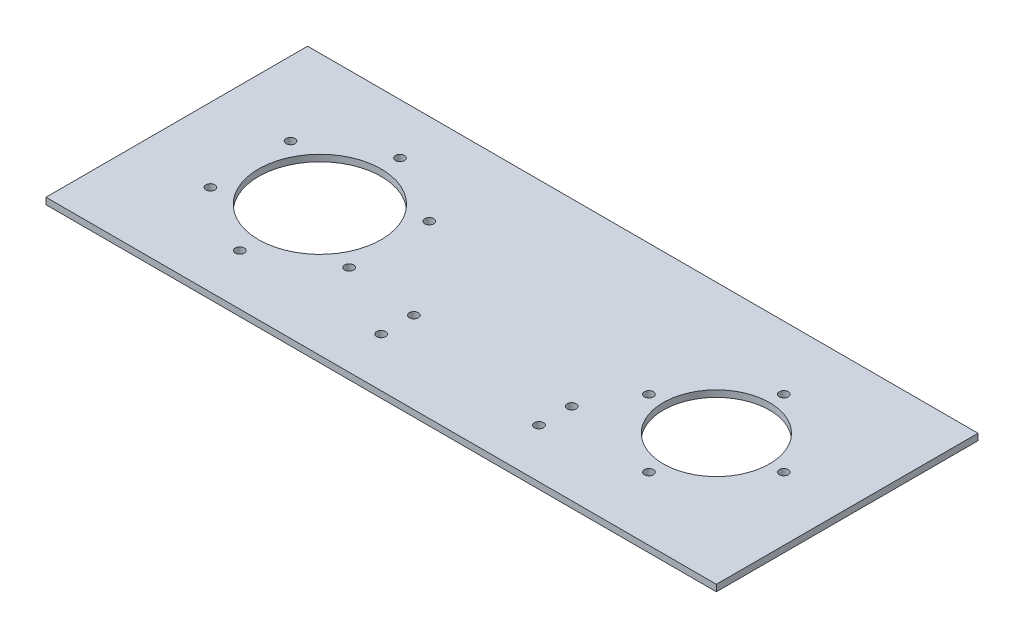
from build123d import *

# Parameters (mm, degrees)
SKETCH1_W           = 820
SKETCH1_H           = 320
SKETCH1_R           = 5.5
SKETCH1_R_2         = 75
SKETCH1_R_3         = 65
BOSS_EXTRUDE1_DEPTH = 8
SKETCH2_R           = 5.5
CUT_EXTRUDE2_DEPTH  = 10


with BuildPart() as part:
    # Sketch1 → Boss-Extrude1 (new body)
    with BuildSketch(Plane(origin=(0, 0, 0), x_dir=(1, 0, 0), z_dir=(0, 1, 0))):
        with Locations((235, 0)):
            Rectangle(SKETCH1_W, SKETCH1_H)
        with Locations((0, -98)):
            Circle(SKETCH1_R, mode=Mode.SUBTRACT)
        with Locations((-84.870489571, -49)):
            Circle(SKETCH1_R, mode=Mode.SUBTRACT)
        with Locations((84.870489571, -49)):
            Circle(SKETCH1_R, mode=Mode.SUBTRACT)
        with Locations((485, -82.5)):
            Circle(SKETCH1_R, mode=Mode.SUBTRACT)
        Circle(SKETCH1_R_2, mode=Mode.SUBTRACT)
        with Locations((-84.870489571, 49)):
            Circle(SKETCH1_R, mode=Mode.SUBTRACT)
        with Locations((84.870489571, 49)):
            Circle(SKETCH1_R, mode=Mode.SUBTRACT)
        with Locations((0, 98)):
            Circle(SKETCH1_R, mode=Mode.SUBTRACT)
        with Locations((402.5, 0)):
            Circle(SKETCH1_R, mode=Mode.SUBTRACT)
        with Locations((485, 0)):
            Circle(SKETCH1_R_3, mode=Mode.SUBTRACT)
        with Locations((567.5, 0)):
            Circle(SKETCH1_R, mode=Mode.SUBTRACT)
        with Locations((485, 82.5)):
            Circle(SKETCH1_R, mode=Mode.SUBTRACT)
    extrude(amount=BOSS_EXTRUDE1_DEPTH)

    # Sketch2 → Cut-Extrude2 (cut)
    with BuildSketch(Plane(origin=(0, 0, 0), x_dir=(1, 0, 0), z_dir=(0, 1, 0))):
        with Locations((175, -60)):
            Circle(SKETCH2_R)
        with Locations((175, -100)):
            Circle(SKETCH2_R)
        with Locations((368, -100)):
            Circle(SKETCH2_R)
        with Locations((368, -60)):
            Circle(SKETCH2_R)
    extrude(amount=CUT_EXTRUDE2_DEPTH, mode=Mode.SUBTRACT)


solid = part.part
